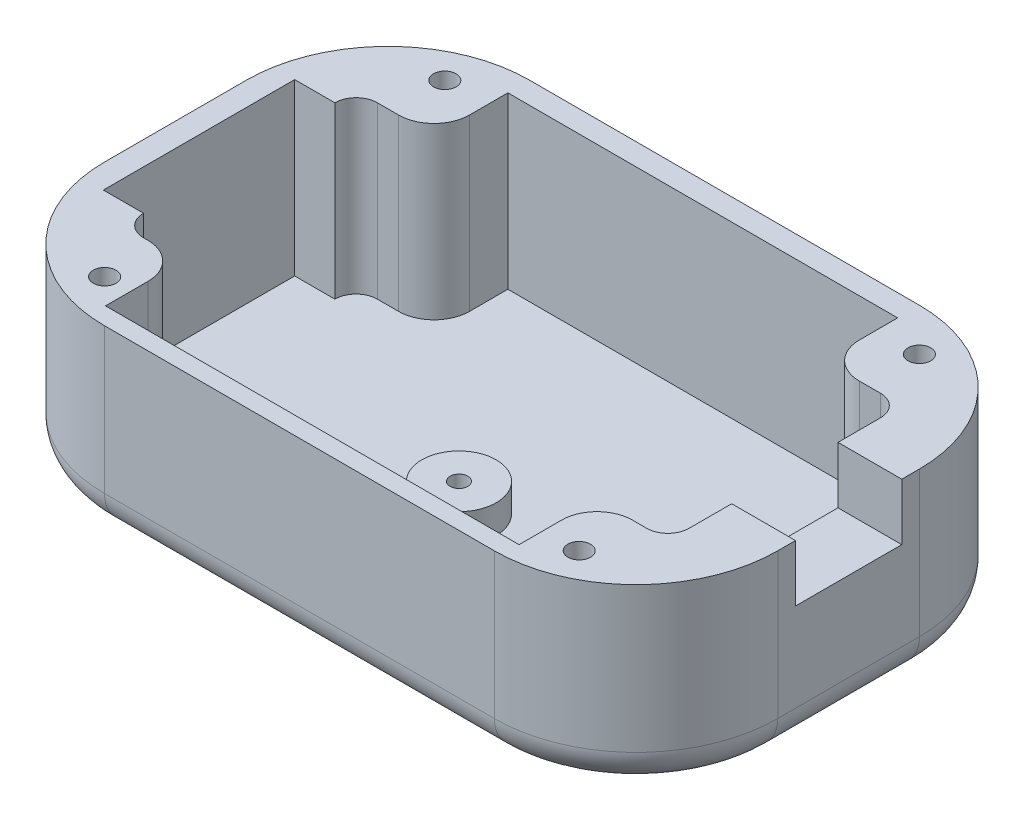
from build123d import *

# Parameters (mm, degrees)
SKETCH2_R           = 1.6
SKETCH2_W           = 24
SKETCH2_H           = 11
SKETCH2_H_2         = 3
SKETCH2_R_2         = 1.25
BOSS_EXTRUDE1_DEPTH = 1.5
BOSS_EXTRUDE2_START = 1.5
SKETCH2_3_R         = 1.6
BOSS_EXTRUDE2_DEPTH = 24
SKETCH3_R           = 5.25
SKETCH3_R_2         = 1.25
BOSS_EXTRUDE3_DEPTH = 4
FILLET1_R           = 10
SKETCH4_R           = 1.3
CUT_EXTRUDE1_DEPTH  = 7
SKETCH5_R           = 3.1
CUT_EXTRUDE2_DEPTH  = 15
FILLET2_R           = 5
SKETCH6_W           = 15
SKETCH6_H           = 9
CUT_EXTRUDE3_DEPTH  = 15
SKETCH7_W           = 12
SKETCH7_H           = 6
CUT_EXTRUDE4_DEPTH  = 15
SKETCH10_W          = 5.662079196
SKETCH10_H          = 27
SKETCH10_W_2        = 55
SKETCH10_H_2        = 10.417373492
CUT_EXTRUDE5_DEPTH  = 24
FILLET6_R           = 5


with BuildPart() as part:
    # Sketch2 → Boss-Extrude1 (new body)
    # profile 1 of 4: a face of its own
    with BuildSketch(Plane(origin=(0, 0, 0), x_dir=(1, 0, 0), z_dir=(0, 1, 0))):
        with BuildLine():
            Line((27.5, 30), (-27.5, 30))
            ThreePointArc((-27.5, 30), (-41.642135624, 24.142135624), (-47.5, 10))
            Line((-47.5, 10), (-47.5, -10))
            ThreePointArc((-47.5, -10), (-41.642135624, -24.142135624), (-27.5, -30))
            Line((-27.5, -30), (27.5, -30))
            ThreePointArc((27.5, -30), (41.642135624, -24.142135624), (47.5, -10))
            Line((47.5, -10), (47.5, 10))
            ThreePointArc((47.5, 10), (41.642135624, 24.142135624), (27.5, 30))
        make_face()
        with Locations(Location((-33.480589606, -24, 0), (0, 0, 270))):
            Circle(SKETCH2_R, mode=Mode.SUBTRACT)
        with Locations(Location((33.480589606, -24, 0), (0, 0, 270))):
            Circle(SKETCH2_R, mode=Mode.SUBTRACT)
        with BuildLine():
            ThreePointArc((-38.5, 13.5), (-37.621320344, 15.621320344), (-35.5, 16.5))
            Line((-35.5, 16.5), (35.5, 16.5))
            ThreePointArc((35.5, 16.5), (37.621320344, 15.621320344), (38.5, 13.5))
            Line((38.5, 13.5), (38.5, -13.5))
            ThreePointArc((38.5, -13.5), (37.621320344, -15.621320344), (35.5, -16.5))
            Line((35.5, -16.5), (12, -16.5))
            Line((12, -16.5), (12, -27.5))
            Line((12, -27.5), (-12, -27.5))
            Line((-12, -27.5), (-12, -16.5))
            Line((-12, -16.5), (-35.5, -16.5))
            ThreePointArc((-35.5, -16.5), (-37.621320344, -15.621320344), (-38.5, -13.5))
            Line((-38.5, -13.5), (-38.5, 13.5))
        make_face(mode=Mode.SUBTRACT)
        with Locations(Location((-33.480589606, 24, 0), (0, 0, 270))):
            Circle(SKETCH2_R, mode=Mode.SUBTRACT)
        with Locations(Location((33.480589606, 24, 0), (0, 0, 270))):
            Circle(SKETCH2_R, mode=Mode.SUBTRACT)
    # profile 2 of 4: a face of its own
    with BuildSketch(Plane(origin=(0, 0, 0), x_dir=(1, 0, 0), z_dir=(0, 1, 0))):
        with Locations((0, -22)):
            Rectangle(SKETCH2_W, SKETCH2_H)
    # profile 3 of 4: a face of its own
    with BuildSketch(Plane(origin=(0, 0, 0), x_dir=(1, 0, 0), z_dir=(0, 1, 0))):
        with Locations((0, -15)):
            Rectangle(SKETCH2_W, SKETCH2_H_2)
    # profile 4 of 4: a face of its own
    with BuildSketch(Plane(origin=(0, 0, 0), x_dir=(1, 0, 0), z_dir=(0, 1, 0))):
        with BuildLine():
            Line((35.5, 16.5), (-35.5, 16.5))
            ThreePointArc((-35.5, 16.5), (-37.621320344, 15.621320344), (-38.5, 13.5))
            Line((-38.5, 13.5), (-38.5, -13.5))
            ThreePointArc((-38.5, -13.5), (-37.621320344, -15.621320344), (-35.5, -16.5))
            Line((-35.5, -16.5), (-12, -16.5))
            Line((-12, -16.5), (-12, -13.5))
            Line((-12, -13.5), (12, -13.5))
            Line((12, -13.5), (12, -16.5))
            Line((12, -16.5), (35.5, -16.5))
            ThreePointArc((35.5, -16.5), (37.621320344, -15.621320344), (38.5, -13.5))
            Line((38.5, -13.5), (38.5, 13.5))
            ThreePointArc((38.5, 13.5), (37.621320344, 15.621320344), (35.5, 16.5))
        make_face()
        with Locations(Location((-3.480589606, -4, 0), (0, 0, 270))):
            Circle(SKETCH2_R_2, mode=Mode.SUBTRACT)
        with Locations(Location((22, -4, 0), (0, 0, 270))):
            Circle(SKETCH2_R_2, mode=Mode.SUBTRACT)
    extrude(amount=BOSS_EXTRUDE1_DEPTH)

    # Sketch2<3> → Boss-Extrude2 (add)
    with BuildSketch(Plane(origin=(0, 0, 0), x_dir=(1, 0, 0), z_dir=(0, 1, 0)).offset(BOSS_EXTRUDE2_START)):
        with BuildLine():
            Line((27.5, 30), (-27.5, 30))
            ThreePointArc((-27.5, 30), (-41.642135624, 24.142135624), (-47.5, 10))
            Line((-47.5, 10), (-47.5, -10))
            ThreePointArc((-47.5, -10), (-41.642135624, -24.142135624), (-27.5, -30))
            Line((-27.5, -30), (27.5, -30))
            ThreePointArc((27.5, -30), (41.642135624, -24.142135624), (47.5, -10))
            Line((47.5, -10), (47.5, 10))
            ThreePointArc((47.5, 10), (41.642135624, 24.142135624), (27.5, 30))
        make_face()
        with Locations(Location((-33.480589606, -24, 0), (0, 0, 270))):
            Circle(SKETCH2_3_R, mode=Mode.SUBTRACT)
        with Locations(Location((33.480589606, -24, 0), (0, 0, 270))):
            Circle(SKETCH2_3_R, mode=Mode.SUBTRACT)
        with BuildLine():
            ThreePointArc((-38.5, 13.5), (-37.621320344, 15.621320344), (-35.5, 16.5))
            Line((-35.5, 16.5), (35.5, 16.5))
            ThreePointArc((35.5, 16.5), (37.621320344, 15.621320344), (38.5, 13.5))
            Line((38.5, 13.5), (38.5, -13.5))
            ThreePointArc((38.5, -13.5), (37.621320344, -15.621320344), (35.5, -16.5))
            Line((35.5, -16.5), (12, -16.5))
            Line((12, -16.5), (12, -27.5))
            Line((12, -27.5), (-12, -27.5))
            Line((-12, -27.5), (-12, -16.5))
            Line((-12, -16.5), (-35.5, -16.5))
            ThreePointArc((-35.5, -16.5), (-37.621320344, -15.621320344), (-38.5, -13.5))
            Line((-38.5, -13.5), (-38.5, 13.5))
        make_face(mode=Mode.SUBTRACT)
        with Locations(Location((-33.480589606, 24, 0), (0, 0, 270))):
            Circle(SKETCH2_3_R, mode=Mode.SUBTRACT)
        with Locations(Location((33.480589606, 24, 0), (0, 0, 270))):
            Circle(SKETCH2_3_R, mode=Mode.SUBTRACT)
    extrude(amount=BOSS_EXTRUDE2_DEPTH)

    # Sketch3 → Boss-Extrude3 (add)
    # profile 1 of 2: a face of its own
    with BuildSketch(Plane(origin=(0, 1.5, 0), x_dir=(1, 0, 0), z_dir=(0, 1, 0))):
        with Locations(Location((-3.480589606, -4, 0), (0, 0, 270))):
            Circle(SKETCH3_R)
        with Locations(Location((-3.480589606, -4, 0), (0, 0, 270))):
            Circle(SKETCH3_R_2, mode=Mode.SUBTRACT)
    # profile 2 of 2: a face of its own
    with BuildSketch(Plane(origin=(0, 1.5, 0), x_dir=(1, 0, 0), z_dir=(0, 1, 0))):
        with Locations(Location((22, -4, 0), (0, 0, 270))):
            Circle(SKETCH3_R)
        with Locations(Location((22, -4, 0), (0, 0, 270))):
            Circle(SKETCH3_R_2, mode=Mode.SUBTRACT)
    extrude(amount=BOSS_EXTRUDE3_DEPTH)

    # Fillet1
    fillet1_edges = [part.edges().sort_by_distance(p)[0] for p in [
        (-12, 13.5, 16.5),
        (12, 13.5, 16.5),
    ]]
    fillet(fillet1_edges, radius=FILLET1_R)

    # Sketch4 → Cut-Extrude1 (cut)
    with BuildSketch(Plane(origin=(0, 1.5, 0), x_dir=(1, 0, 0), z_dir=(0, 1, 0))):
        with Locations(Location((-7, -17.5, 0), (0, 0, 270))):
            Circle(SKETCH4_R)
        with Locations(Location((7, -17.5, 0), (0, 0, 270))):
            Circle(SKETCH4_R)
    extrude(amount=-CUT_EXTRUDE1_DEPTH, mode=Mode.SUBTRACT)

    # Sketch5 → Cut-Extrude2 (cut)
    with BuildSketch(Plane.XZ):
        with Locations(Location((-33.480589606, 24, 0), (0, 0, 270))):
            Circle(SKETCH5_R)
        with Locations(Location((-33.480589606, -24, 0), (0, 0, 270))):
            Circle(SKETCH5_R)
        with Locations(Location((33.480589606, -24, 0), (0, 0, 270))):
            Circle(SKETCH5_R)
        with Locations(Location((33.480589606, 24, 0), (0, 0, 270))):
            Circle(SKETCH5_R)
    extrude(amount=-CUT_EXTRUDE2_DEPTH, mode=Mode.SUBTRACT)

    # Fillet2
    # the kernel refuses this fillet: 5 mm, written as the material it takes off along each edge
    with BuildSketch(Plane(origin=(27.5, 0, -10), x_dir=(1, 0, 0), z_dir=(0, 0, 1))) as fillet2_piece_1:
        with BuildLine():
            CenterArc((20 - FILLET2_R, FILLET2_R), FILLET2_R, 270, 90)
            Line((20, FILLET2_R), (20, 0))
            Line((20, 0), (20 - FILLET2_R, 0))
        make_face()
    revolve(axis=Axis((27.5, 0, -10), (0, 1, 0)), revolution_arc=90, mode=Mode.SUBTRACT)
    with BuildSketch(Plane(origin=(47.5, 0, 10), x_dir=(-1, 0, 0), z_dir=(0, 0, -1)), Plane(origin=(-47.5, 0, -10), x_dir=(1, 0, 0), z_dir=(0, 0, 1))) as fillet2_piece_2:
        with BuildLine():
            CenterArc((FILLET2_R, FILLET2_R), FILLET2_R, 180, 90)
            Line((0, FILLET2_R), (0, 0))
            Line((0, 0), (FILLET2_R, 0))
        make_face()
    extrude(amount=20, mode=Mode.SUBTRACT)
    with BuildSketch(Plane(origin=(27.5, 0, 10), x_dir=(0, 0, 1), z_dir=(-1, 0, 0))) as fillet2_piece_3:
        with BuildLine():
            CenterArc((20 - FILLET2_R, FILLET2_R), FILLET2_R, 270, 90)
            Line((20, FILLET2_R), (20, 0))
            Line((20, 0), (20 - FILLET2_R, 0))
        make_face()
    revolve(axis=Axis((27.5, 0, 10), (0, 1, 0)), revolution_arc=90, mode=Mode.SUBTRACT)
    with BuildSketch(Plane(origin=(-27.5, 0, 30), x_dir=(0, 0, -1), z_dir=(1, 0, 0)), Plane(origin=(27.5, 0, -30), x_dir=(0, 0, 1), z_dir=(-1, 0, 0))) as fillet2_piece_4:
        with BuildLine():
            CenterArc((FILLET2_R, FILLET2_R), FILLET2_R, 180, 90)
            Line((0, FILLET2_R), (0, 0))
            Line((0, 0), (FILLET2_R, 0))
        make_face()
    extrude(amount=55, mode=Mode.SUBTRACT)
    with BuildSketch(Plane(origin=(-27.5, 0, 10), x_dir=(-1, 0, 0), z_dir=(0, 0, -1))) as fillet2_piece_5:
        with BuildLine():
            CenterArc((20 - FILLET2_R, FILLET2_R), FILLET2_R, 270, 90)
            Line((20, FILLET2_R), (20, 0))
            Line((20, 0), (20 - FILLET2_R, 0))
        make_face()
    revolve(axis=Axis((-27.5, 0, 10), (0, 1, 0)), revolution_arc=90, mode=Mode.SUBTRACT)
    with BuildSketch(Plane(origin=(-27.5, 0, -10), x_dir=(0, 0, -1), z_dir=(1, 0, 0))) as fillet2_piece_6:
        with BuildLine():
            CenterArc((20 - FILLET2_R, FILLET2_R), FILLET2_R, 270, 90)
            Line((20, FILLET2_R), (20, 0))
            Line((20, 0), (20 - FILLET2_R, 0))
        make_face()
    revolve(axis=Axis((-27.5, 0, -10), (0, 1, 0)), revolution_arc=90, mode=Mode.SUBTRACT)

    # Sketch6 → Cut-Extrude3 (cut)
    with BuildSketch(Plane(origin=(47.5, 0, 0), x_dir=(0, 0, -1), z_dir=(1, 0, 0))):
        with Locations((0, 22)):
            Rectangle(SKETCH6_W, SKETCH6_H)
    extrude(amount=-CUT_EXTRUDE3_DEPTH, mode=Mode.SUBTRACT)

    # Sketch7 → Cut-Extrude4 (cut)
    with BuildSketch(Plane(origin=(0, 25.5, 0), x_dir=(1, 0, 0), z_dir=(0, 1, 0))):
        with Locations((22.5, -19.5)):
            Rectangle(SKETCH7_W, SKETCH7_H)
    extrude(amount=-CUT_EXTRUDE4_DEPTH, mode=Mode.SUBTRACT)

    # Sketch10 → Cut-Extrude5 (cut)
    with BuildSketch(Plane(origin=(0, 25.5, 0), x_dir=(1, 0, 0), z_dir=(0, 1, 0))):
        with Locations((-41.331039598, 0)):
            Rectangle(SKETCH10_W, SKETCH10_H)
        with Locations((0, 21.708686746)):
            Rectangle(SKETCH10_W_2, SKETCH10_H_2)
        with BuildLine():
            Line((-22, -16.5), (-29.856380317, -16.5))
            Line((-29.856380317, -16.5), (-29.856380317, -27.5))
            Line((-29.856380317, -27.5), (-12, -27.5))
            Line((-12, -27.5), (-12, -26.5))
            ThreePointArc((-12, -26.5), (-14.928932188, -19.428932188), (-22, -16.5))
        make_face()
        with BuildLine():
            Line((-12, -16.5), (-22, -16.5))
            ThreePointArc((-22, -16.5), (-14.928932188, -19.428932188), (-12, -26.5))
            Line((-12, -26.5), (-12, -16.5))
        make_face()
        with BuildLine():
            Line((12, -16.5), (12, -26.5))
            ThreePointArc((12, -26.5), (13.196591569, -21.75658351), (16.5, -18.148353456))
            Line((16.5, -18.148353456), (16.5, -22.5))
            Line((16.5, -22.5), (28.5, -22.5))
            Line((28.5, -22.5), (28.5, -16.5))
            Line((28.5, -16.5), (12, -16.5))
        make_face()
        with BuildLine():
            Line((12, -26.5), (12, -27.5))
            Line((12, -27.5), (28.5, -27.5))
            Line((28.5, -27.5), (28.5, -22.5))
            Line((28.5, -22.5), (16.5, -22.5))
            Line((16.5, -22.5), (16.5, -18.148353456))
            ThreePointArc((16.5, -18.148353456), (13.196591569, -21.75658351), (12, -26.5))
        make_face()
    extrude(amount=-CUT_EXTRUDE5_DEPTH, mode=Mode.SUBTRACT)

    # Fillet6
    fillet6_edges = [part.edges().sort_by_distance(p)[0] for p in [
        (28.5, 13.5, 16.5),
        (-29.856380317, 13.5, 16.5),
        (27.5, 13.5, -16.5),
        (-27.5, 13.5, -16.5),
    ]]
    fillet(fillet6_edges, radius=FILLET6_R)


solid = part.part
